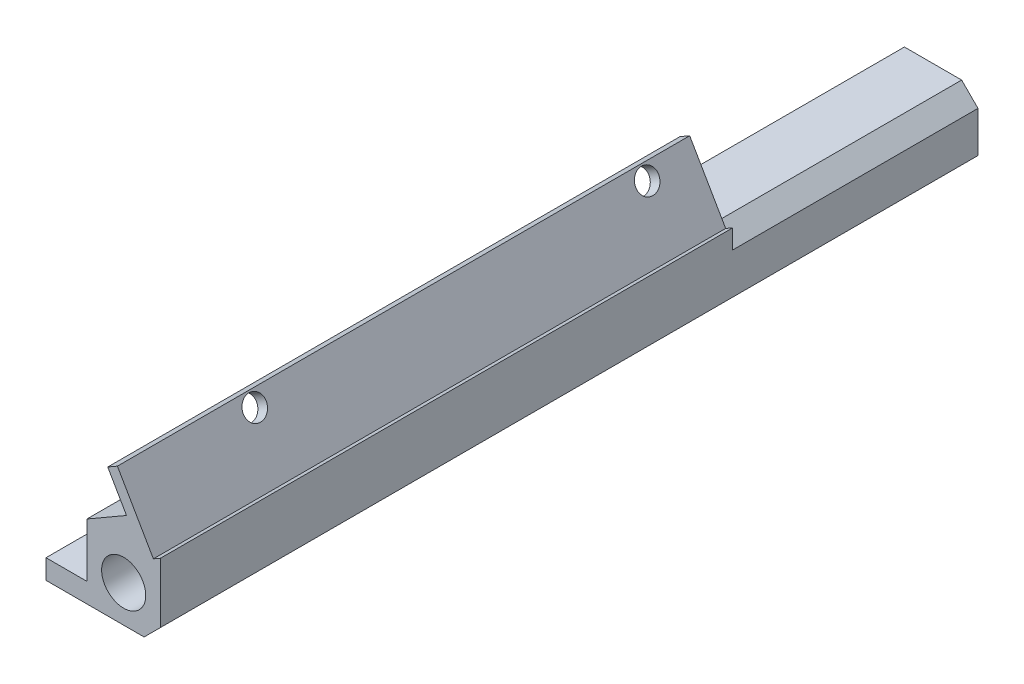
from build123d import *

# Parameters (mm, degrees)
SKETCH1_W           = 77.47
SKETCH1_H           = 127
BOSS_EXTRUDE1_DEPTH = 11.43
SKETCH2_R           = 3.429
CUT_EXTRUDE1_DEPTH  = 150.202030147
CUT_EXTRUDE2_DEPTH  = 150.202030147
SKETCH4_W           = 54.61
SKETCH4_H           = 6.35
CUT_EXTRUDE3_DEPTH  = 150.202030147
CHAMFER1_SIZE       = 2.54
SKETCH5_W           = 66.04
SKETCH5_H           = 50.8
CUT_EXTRUDE4_DEPTH  = 150.202030147
SKETCH6_W           = 53.34
SKETCH6_H           = 76.2
CUT_EXTRUDE5_DEPTH  = 150.202030147
SKETCH7_R           = 1.778
HOLE_CUTS_1_DEPTH   = 149.899037606
BOSS_EXTRUDE2_DEPTH = 88.9
CUT_EXTRUDE7_REACH  = 152.316
SKETCH9_W           = 6.35
SKETCH9_H           = 5.08
CUT_EXTRUDE8_REACH  = 152.316
SKETCH10_W          = 6.35
SKETCH10_H          = 1.27
HOLE_CUTS_2_REACH   = 134.793
SKETCH11_R          = 1.778
SKETCH12_W          = 88.9
SKETCH12_H          = 11.176
CUT_EXTRUDE10_DEPTH = 1.27
SKETCH13_W          = 88.9
SKETCH13_H          = 5.842
CUT_EXTRUDE11_DEPTH = 0.762
SKETCH14_W          = 6.35
SKETCH14_H          = 76.2
CUT_EXTRUDE12_DEPTH = 0.762


with BuildPart() as part:
    # Sketch1 → Boss-Extrude1 (new body)
    with BuildSketch(Plane(origin=(0, 0, 0), x_dir=(1, 0, 0), z_dir=(0, 1, 0))):
        with Locations((38.735, 63.5)):
            Rectangle(SKETCH1_W, SKETCH1_H)
    extrude(amount=BOSS_EXTRUDE1_DEPTH)

    # Sketch2 → Cut-Extrude1 (cut, through all)
    with BuildSketch(Plane.XY):
        with Locations((5.715, 5.715)):
            Circle(SKETCH2_R)
        with Locations((71.755, 5.715)):
            Circle(SKETCH2_R)
    extrude(amount=-CUT_EXTRUDE1_DEPTH, mode=Mode.SUBTRACT)

    # Sketch3 → Cut-Extrude2 (cut, through all)
    with BuildSketch(Plane(origin=(0, 11.43, 0), x_dir=(1, 0, 0), z_dir=(0, 1, 0))):
        with BuildLine():
            Line((11.43, 127), (11.43, 88.9))
            ThreePointArc((11.43, 88.9), (15.149743879, 79.919743879), (24.13, 76.2))
            Line((24.13, 76.2), (53.34, 76.2))
            ThreePointArc((53.34, 76.2), (62.320256121, 79.919743879), (66.04, 88.9))
            Line((66.04, 88.9), (66.04, 127))
            Line((66.04, 127), (11.43, 127))
        make_face()
    extrude(amount=-CUT_EXTRUDE2_DEPTH, mode=Mode.SUBTRACT)

    # Sketch4 → Cut-Extrude3 (cut, through all)
    with BuildSketch(Plane(origin=(0, 0, -127), x_dir=(-1, 0, 0), z_dir=(0, 0, -1))):
        with Locations((-38.735, 8.255)):
            Rectangle(SKETCH4_W, SKETCH4_H)
    extrude(amount=-CUT_EXTRUDE3_DEPTH, mode=Mode.SUBTRACT)

    # Chamfer1
    chamfer1_edges = [part.edges().sort_by_distance(p)[0] for p in [
        (0, 0, -63.5),
        (0, 11.43, -63.5),
        (77.47, 0, -63.5),
        (77.47, 11.43, -63.5),
    ]]
    chamfer(chamfer1_edges, length=CHAMFER1_SIZE)

    # Sketch5 → Cut-Extrude4 (cut, through all)
    with BuildSketch(Plane(origin=(0, 11.43, 0), x_dir=(1, 0, 0), z_dir=(0, 1, 0))):
        with Locations((33.02, 101.6)):
            Rectangle(SKETCH5_W, SKETCH5_H)
    extrude(amount=-CUT_EXTRUDE4_DEPTH, mode=Mode.SUBTRACT)

    # Sketch6 → Cut-Extrude5 (cut, through all)
    with BuildSketch(Plane(origin=(0, 11.43, 0), x_dir=(1, 0, 0), z_dir=(0, 1, 0))):
        with Locations((26.67, 38.1)):
            Rectangle(SKETCH6_W, SKETCH6_H)
    extrude(amount=-CUT_EXTRUDE5_DEPTH, mode=Mode.SUBTRACT)

    # Sketch7 → Hole Cuts 1 (cut, through all)
    with BuildSketch(Plane(origin=(0, 5.08, 0), x_dir=(1, 0, 0), z_dir=(0, 1, 0))):
        with Locations((62.23, 68.58)):
            Circle(SKETCH7_R)
        with Locations((62.23, 7.62)):
            Circle(SKETCH7_R)
    extrude(amount=-HOLE_CUTS_1_DEPTH, mode=Mode.SUBTRACT)

    # Sketch8 → Boss-Extrude2 (add)
    with BuildSketch(Plane.XY):
        Polygon((77.47, 11.869940905), (77.47, 7.030590949), (74.93, 11.43), (66.04, 11.43), (71.539261314, 14.605), (68.618261314, 19.664320409), (71.882, 21.548640818), align=None)
    extrude(amount=-BOSS_EXTRUDE2_DEPTH)

    # Sketch9 → Cut-Extrude7 (cut, up to next)
    with BuildSketch(Plane.XY, mode=Mode.PRIVATE) as cut_extrude7_sk1:
        with Locations((56.515, 2.54)):
            Rectangle(SKETCH9_W, SKETCH9_H)
    cut_extrude7_tool1 = extrude(cut_extrude7_sk1.sketch, amount=-CUT_EXTRUDE7_REACH, mode=Mode.PRIVATE) & part.part
    add(cut_extrude7_tool1.solids().sort_by_distance((56.515, 2.54, 0))[0], mode=Mode.SUBTRACT)

    # Sketch10 → Cut-Extrude8 (cut, up to next)
    with BuildSketch(Plane.XY, mode=Mode.PRIVATE) as cut_extrude8_sk1:
        with Locations((62.865, 4.445)):
            Rectangle(SKETCH10_W, SKETCH10_H)
    cut_extrude8_tool1 = extrude(cut_extrude8_sk1.sketch, amount=-CUT_EXTRUDE8_REACH, mode=Mode.PRIVATE) & part.part
    add(cut_extrude8_tool1.solids().sort_by_distance((62.865, 4.445, 0))[0], mode=Mode.SUBTRACT)

    # Sketch11 → Hole Cuts 2 (cut, up to next)
    with BuildSketch(Plane(origin=(59.978596497, 34.628658833, 0), x_dir=(0, 0, 1), z_dir=(-0.8660254037844403, -0.49999999999999745, 0)), mode=Mode.PRIVATE) as hole_cuts_2_sk1:
        with Locations((-20.32, -19.311329635)):
            Circle(SKETCH11_R)
    hole_cuts_2_tool1 = extrude(hole_cuts_2_sk1.sketch, amount=-HOLE_CUTS_2_REACH, mode=Mode.PRIVATE) & part.part
    # Sketch11 → Hole Cuts 2 (cut, up to next)
    with BuildSketch(Plane(origin=(59.978596497, 34.628658833, 0), x_dir=(0, 0, 1), z_dir=(-0.8660254037844403, -0.49999999999999745, 0)), mode=Mode.PRIVATE) as hole_cuts_2_sk2:
        with Locations((-81.28, -19.311329635)):
            Circle(SKETCH11_R)
    hole_cuts_2_tool2 = extrude(hole_cuts_2_sk2.sketch, amount=-HOLE_CUTS_2_REACH, mode=Mode.PRIVATE) & part.part
    add(hole_cuts_2_tool1.solids().sort_by_distance((69.634261, 17.904557, -20.32))[0], mode=Mode.SUBTRACT)
    add(hole_cuts_2_tool2.solids().sort_by_distance((69.634261, 17.904557, -81.28))[0], mode=Mode.SUBTRACT)

    # Sketch12 → Cut-Extrude10 (cut)
    with BuildSketch(Plane(origin=(63.242335183, 36.512979242, 0), x_dir=(0, 0, -1), z_dir=(0.8660254037844395, 0.49999999999999856, 0))):
        with Locations((44.45, -22.867329635)):
            Rectangle(SKETCH12_W, SKETCH12_H)
    extrude(amount=-CUT_EXTRUDE10_DEPTH, mode=Mode.SUBTRACT)

    # Sketch13 → Cut-Extrude11 (cut)
    with BuildSketch(Plane(origin=(59.978596497, 34.628658833, 0), x_dir=(0, 0, 1), z_dir=(-0.8660254037844393, -0.49999999999999906, 0))):
        with Locations((-44.45, -20.200329635)):
            Rectangle(SKETCH13_W, SKETCH13_H)
    extrude(amount=-CUT_EXTRUDE11_DEPTH, mode=Mode.SUBTRACT)

    # Sketch14 → Cut-Extrude12 (cut)
    with BuildSketch(Plane(origin=(0, 3.81, 0), x_dir=(1, 0, 0), z_dir=(0, 1, 0))):
        with Locations((62.865, 38.1)):
            Rectangle(SKETCH14_W, SKETCH14_H)
    extrude(amount=-CUT_EXTRUDE12_DEPTH, mode=Mode.SUBTRACT)


solid = part.part
